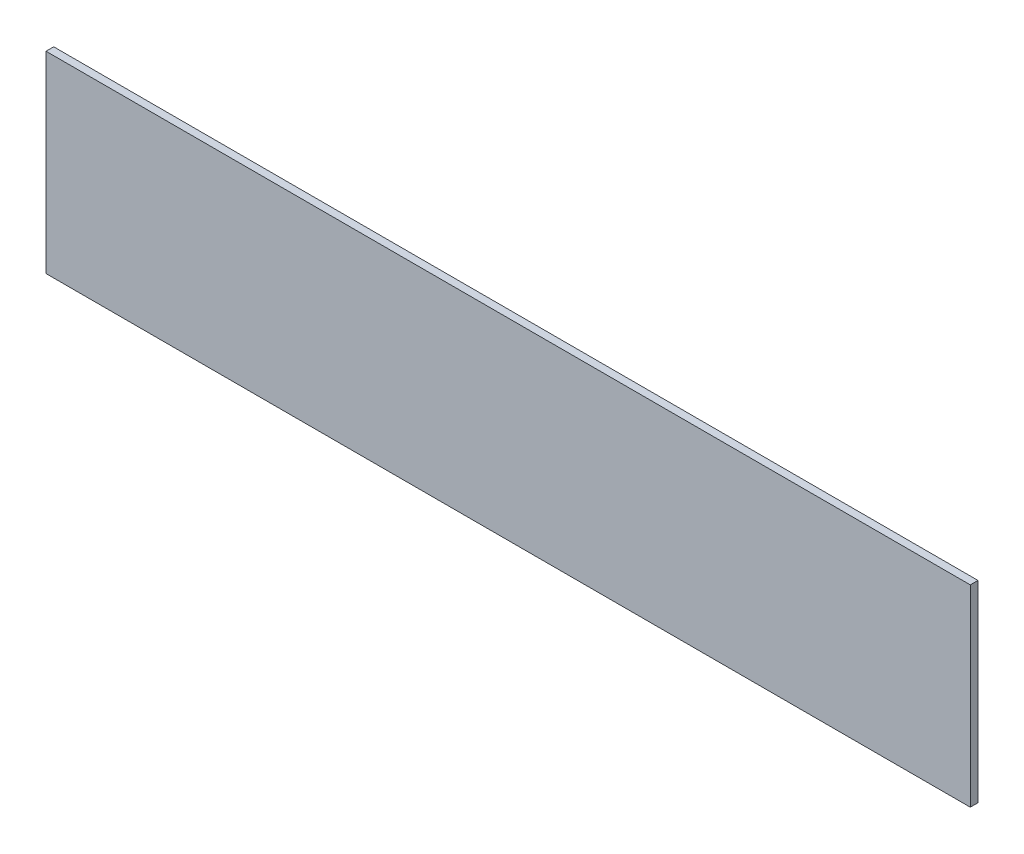
from build123d import *

# Parameters (mm, degrees)
IZIM1_W            = 2400
IZIM1_H            = 500
TABAN_FLAN_1_DEPTH = 20


# Sheet-metal steps are written as plain solids
with BuildPart() as part:
    # Çizim1 → Taban-Flanş1 (new body)
    with BuildSketch(Plane.XY):
        with Locations((1200, -250)):
            Rectangle(IZIM1_W, IZIM1_H)
    extrude(amount=-TABAN_FLAN_1_DEPTH)


solid = part.part
